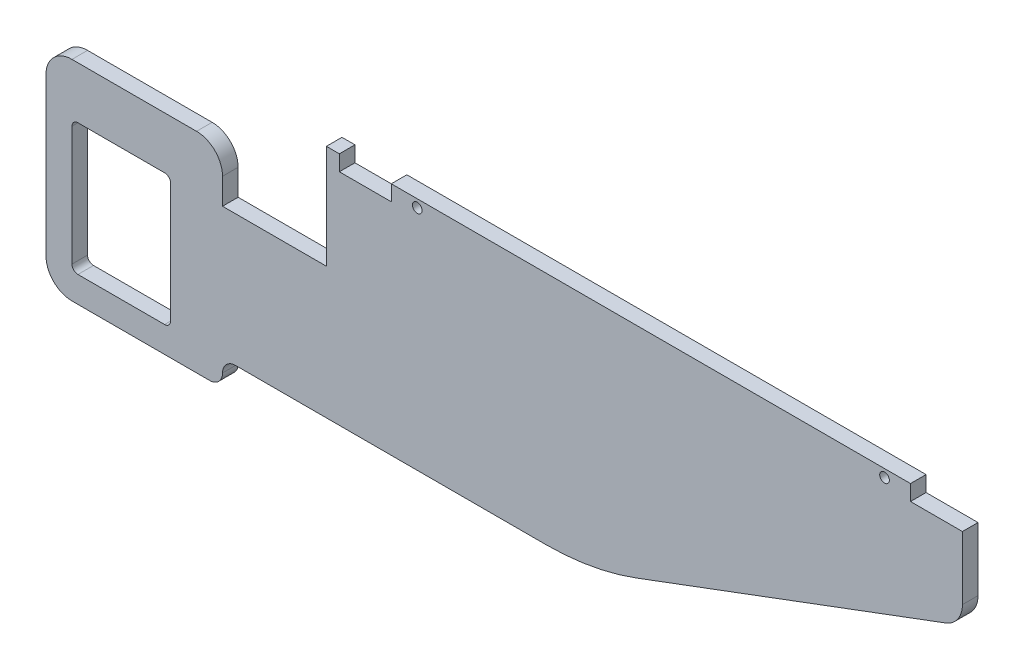
from build123d import *

# Parameters (mm, degrees)
SKETCH1_R      = 1.86
EXTRUDE1_DEPTH = 6
FILLET1_R      = 10
FILLET2_R      = 5
FILLET4_R      = 100


with BuildPart() as part:
    # Sketch1 → Extrude1 (new body)
    with BuildSketch(Plane.XY):
        Polygon((58, 0), (58, -10), (-10, -10), (-10, 70.6), (58, 70.6), (58, 58.440884087), (58, 50.6), (98, 50.6), (98, 90.6), (103, 90.6), (103, 84.6), (123, 84.6), (123, 90.6), (323, 90.6), (323, 84.6), (343, 84.6), (343, 53.268621992), (200.6, 0), align=None)
        with Locations((313, 87.6)):
            Circle(SKETCH1_R, mode=Mode.SUBTRACT)
        with Locations((133, 87.6)):
            Circle(SKETCH1_R, mode=Mode.SUBTRACT)
        with BuildLine():
            Line((2.3, 50.6), (35.7, 50.6))
            ThreePointArc((35.7, 50.6), (37.326345597, 49.926345597), (38, 48.3))
            Line((38, 48.3), (38, 2.3))
            ThreePointArc((38, 2.3), (37.326345597, 0.673654403), (35.7, 0))
            Line((35.7, 0), (2.3, 0))
            ThreePointArc((2.3, 0), (0.673654403, 0.673654403), (0, 2.3))
            Line((0, 2.3), (0, 48.3))
            ThreePointArc((0, 48.3), (0.673654403, 49.926345597), (2.3, 50.6))
        make_face(mode=Mode.SUBTRACT)
    extrude(amount=EXTRUDE1_DEPTH)

    # Fillet1
    fillet1_edges = [part.edges().sort_by_distance(p)[0] for p in [
        (343, 53.268621992, 3),
        (-10, -10, 3),
        (-10, 70.6, 3),
        (58, 70.6, 3),
    ]]
    fillet(fillet1_edges, radius=FILLET1_R)

    # Fillet2
    fillet2_edges = [part.edges().sort_by_distance(p)[0] for p in [
        (58, 0, 3),
    ]]
    fillet(fillet2_edges, radius=FILLET2_R)
    fillet2_2_edges = [part.edges().sort_by_distance(p)[0] for p in [
        (58, -10, 3),
    ]]
    fillet(fillet2_2_edges, radius=FILLET2_R - 0.0001)  # a hair under: the kernel refuses the full size

    # Fillet4
    fillet4_edges = [part.edges().sort_by_distance(p)[0] for p in [
        (200.6, 0, 3),
    ]]
    fillet(fillet4_edges, radius=FILLET4_R)


solid = part.part
